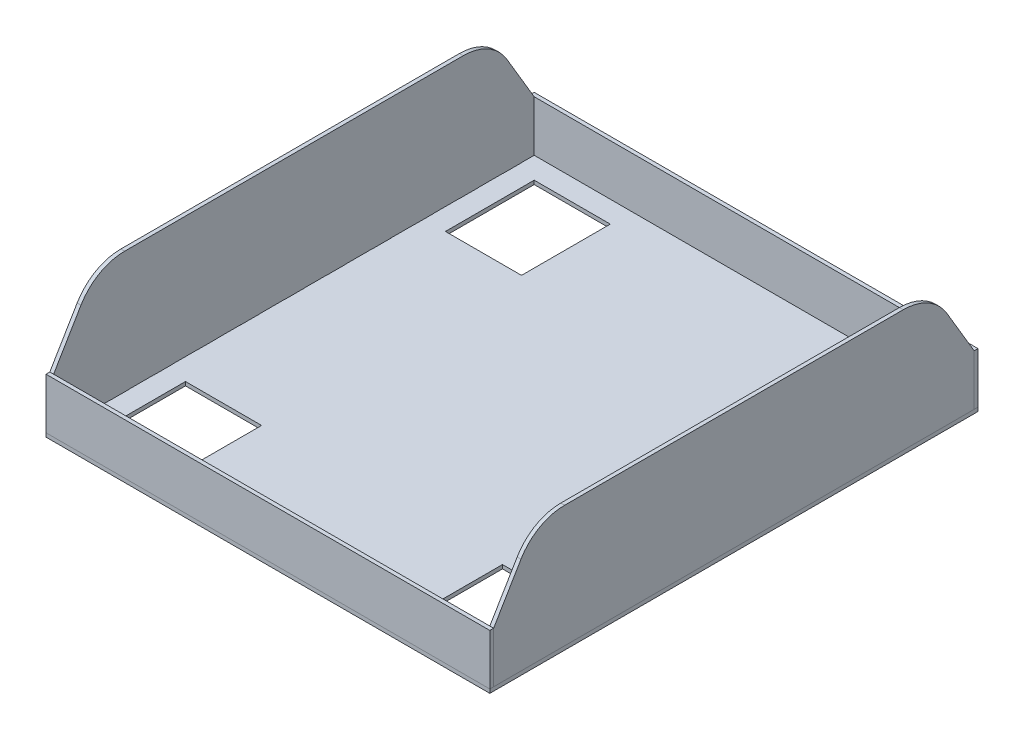
from build123d import *

# Parameters (mm, degrees)
CROQUIS1_W                             = 350
CROQUIS1_H                             = 385
CROQUIS1_W_2                           = 60
CROQUIS1_H_2                           = 70
SALIENTE_EXTRUIR1_DEPTH                = 3
CROQUIS4_W                             = 350
CROQUIS4_H                             = 3
SALIENTE_EXTRUIR4_DEPTH                = 40
CROQUIS5_W                             = 350
CROQUIS5_H                             = 3
SALIENTE_EXTRUIR5_DEPTH                = 40
SALIENTE_EXTRUIR6_DEPTH                = 3
SALIENTE_EXTRUIR7_DEPTH                = 3
PESTA_A_START                          = -179.5
PESTA_A_Y_RANURA_PESTA_A1_OUTLINE_W    = 3
PESTA_A_Y_RANURA_PESTA_A1_OUTLINE_H    = 3
PESTA_A_Y_RANURA_PESTA_A1_DEPTH        = 15
PESTA_A_START_2                        = -145.1
PESTA_A_Y_RANURA_PESTA_A1_2_OUTLINE_W  = 3
PESTA_A_Y_RANURA_PESTA_A1_2_OUTLINE_H  = 3
PESTA_A_Y_RANURA_PESTA_A1_2_DEPTH      = 15
PESTA_A_START_3                        = -110.7
PESTA_A_Y_RANURA_PESTA_A1_3_OUTLINE_W  = 3
PESTA_A_Y_RANURA_PESTA_A1_3_OUTLINE_H  = 3
PESTA_A_Y_RANURA_PESTA_A1_3_DEPTH      = 15
PESTA_A_START_4                        = -76.3
PESTA_A_Y_RANURA_PESTA_A1_4_OUTLINE_W  = 3
PESTA_A_Y_RANURA_PESTA_A1_4_OUTLINE_H  = 3
PESTA_A_Y_RANURA_PESTA_A1_4_DEPTH      = 15
PESTA_A_START_5                        = -41.9
PESTA_A_Y_RANURA_PESTA_A1_5_OUTLINE_W  = 3
PESTA_A_Y_RANURA_PESTA_A1_5_OUTLINE_H  = 3
PESTA_A_Y_RANURA_PESTA_A1_5_DEPTH      = 15
PESTA_A_START_6                        = -7.5
PESTA_A_Y_RANURA_PESTA_A1_6_OUTLINE_W  = 3
PESTA_A_Y_RANURA_PESTA_A1_6_OUTLINE_H  = 3
PESTA_A_Y_RANURA_PESTA_A1_6_DEPTH      = 15
PESTA_A_START_7                        = 26.9
PESTA_A_Y_RANURA_PESTA_A1_7_OUTLINE_W  = 3
PESTA_A_Y_RANURA_PESTA_A1_7_OUTLINE_H  = 3
PESTA_A_Y_RANURA_PESTA_A1_7_DEPTH      = 15
PESTA_A_START_8                        = 61.3
PESTA_A_Y_RANURA_PESTA_A1_8_OUTLINE_W  = 3
PESTA_A_Y_RANURA_PESTA_A1_8_OUTLINE_H  = 3
PESTA_A_Y_RANURA_PESTA_A1_8_DEPTH      = 15
PESTA_A_START_9                        = 95.7
PESTA_A_Y_RANURA_PESTA_A1_9_OUTLINE_W  = 3
PESTA_A_Y_RANURA_PESTA_A1_9_OUTLINE_H  = 3
PESTA_A_Y_RANURA_PESTA_A1_9_DEPTH      = 15
PESTA_A_START_10                       = 130.1
PESTA_A_Y_RANURA_PESTA_A1_10_OUTLINE_W = 3
PESTA_A_Y_RANURA_PESTA_A1_10_OUTLINE_H = 3
PESTA_A_Y_RANURA_PESTA_A1_10_DEPTH     = 15
PESTA_A_START_11                       = 164.5
PESTA_A_Y_RANURA_PESTA_A1_11_OUTLINE_W = 3
PESTA_A_Y_RANURA_PESTA_A1_11_OUTLINE_H = 3
PESTA_A_Y_RANURA_PESTA_A1_11_DEPTH     = 15
PESTA_A_START_12                       = -179.6
PESTA_A_Y_RANURA_RANURA1_OUTLINE_W     = 3.1
PESTA_A_Y_RANURA_RANURA1_OUTLINE_H     = 3
PESTA_A_Y_RANURA_RANURA1_DEPTH         = 15.2
PESTA_A_START_13                       = -145.2
PESTA_A_Y_RANURA_RANURA1_2_OUTLINE_W   = 3.1
PESTA_A_Y_RANURA_RANURA1_2_OUTLINE_H   = 3
PESTA_A_Y_RANURA_RANURA1_2_DEPTH       = 15.2
PESTA_A_START_14                       = -110.8
PESTA_A_Y_RANURA_RANURA1_3_OUTLINE_W   = 3.1
PESTA_A_Y_RANURA_RANURA1_3_OUTLINE_H   = 3
PESTA_A_Y_RANURA_RANURA1_3_DEPTH       = 15.2
PESTA_A_START_15                       = -76.4
PESTA_A_Y_RANURA_RANURA1_4_OUTLINE_W   = 3.1
PESTA_A_Y_RANURA_RANURA1_4_OUTLINE_H   = 3
PESTA_A_Y_RANURA_RANURA1_4_DEPTH       = 15.2
PESTA_A_START_16                       = -42
PESTA_A_Y_RANURA_RANURA1_5_OUTLINE_W   = 3.1
PESTA_A_Y_RANURA_RANURA1_5_OUTLINE_H   = 3
PESTA_A_Y_RANURA_RANURA1_5_DEPTH       = 15.2
PESTA_A_START_17                       = -7.6
PESTA_A_Y_RANURA_RANURA1_6_OUTLINE_W   = 3.1
PESTA_A_Y_RANURA_RANURA1_6_OUTLINE_H   = 3
PESTA_A_Y_RANURA_RANURA1_6_DEPTH       = 15.2
PESTA_A_START_18                       = 26.8
PESTA_A_Y_RANURA_RANURA1_7_OUTLINE_W   = 3.1
PESTA_A_Y_RANURA_RANURA1_7_OUTLINE_H   = 3
PESTA_A_Y_RANURA_RANURA1_7_DEPTH       = 15.2
PESTA_A_START_19                       = 61.2
PESTA_A_Y_RANURA_RANURA1_8_OUTLINE_W   = 3.1
PESTA_A_Y_RANURA_RANURA1_8_OUTLINE_H   = 3
PESTA_A_Y_RANURA_RANURA1_8_DEPTH       = 15.2
PESTA_A_START_20                       = 95.6
PESTA_A_Y_RANURA_RANURA1_9_OUTLINE_W   = 3.1
PESTA_A_Y_RANURA_RANURA1_9_OUTLINE_H   = 3
PESTA_A_Y_RANURA_RANURA1_9_DEPTH       = 15.2
PESTA_A_START_21                       = 130
PESTA_A_Y_RANURA_RANURA1_10_OUTLINE_W  = 3.1
PESTA_A_Y_RANURA_RANURA1_10_OUTLINE_H  = 3
PESTA_A_Y_RANURA_RANURA1_10_DEPTH      = 15.2
PESTA_A_START_22                       = 164.4
PESTA_A_Y_RANURA_RANURA1_11_OUTLINE_W  = 3.1
PESTA_A_Y_RANURA_RANURA1_11_OUTLINE_H  = 3
PESTA_A_Y_RANURA_RANURA1_11_DEPTH      = 15.2


# Read off the part's stored shape, not the designer's step: Pestaña y ranura-Pestaña1, Pestaña y ranura-Ranura1
with BuildPart() as part:
    # Croquis1 → Saliente-Extruir1 (new body)
    with BuildSketch(Plane(origin=(0, 0, 0), x_dir=(1, 0, 0), z_dir=(0, 1, 0))):
        Rectangle(CROQUIS1_W, CROQUIS1_H)
        with Locations((-125, 137.5)):
            Rectangle(CROQUIS1_W_2, CROQUIS1_H_2, mode=Mode.SUBTRACT)
        with Locations((125, 137.5)):
            Rectangle(CROQUIS1_W_2, CROQUIS1_H_2, mode=Mode.SUBTRACT)
        with Locations((-125, -137.5)):
            Rectangle(CROQUIS1_W_2, CROQUIS1_H_2, mode=Mode.SUBTRACT)
        with Locations((125, -137.5)):
            Rectangle(CROQUIS1_W_2, CROQUIS1_H_2, mode=Mode.SUBTRACT)
    extrude(amount=SALIENTE_EXTRUIR1_DEPTH)

    # Pestaña y ranura-Ranura1 outline → Pestaña y ranura-Ranura1 (cut)
    with BuildSketch(Plane.XY.offset(PESTA_A_START_12)):
        with Locations((-173.45, 1.5)):
            Rectangle(PESTA_A_Y_RANURA_RANURA1_OUTLINE_W, PESTA_A_Y_RANURA_RANURA1_OUTLINE_H)
    extrude(amount=PESTA_A_Y_RANURA_RANURA1_DEPTH, mode=Mode.SUBTRACT)

    # Pesta_a y ranura-Ranura1 2 outline → Pesta_a y ranura-Ranura1 2 (cut)
    with BuildSketch(Plane.XY.offset(PESTA_A_START_13)):
        with Locations((-173.45, 1.5)):
            Rectangle(PESTA_A_Y_RANURA_RANURA1_2_OUTLINE_W, PESTA_A_Y_RANURA_RANURA1_2_OUTLINE_H)
    extrude(amount=PESTA_A_Y_RANURA_RANURA1_2_DEPTH, mode=Mode.SUBTRACT)

    # Pesta_a y ranura-Ranura1 3 outline → Pesta_a y ranura-Ranura1 3 (cut)
    with BuildSketch(Plane.XY.offset(PESTA_A_START_14)):
        with Locations((-173.45, 1.5)):
            Rectangle(PESTA_A_Y_RANURA_RANURA1_3_OUTLINE_W, PESTA_A_Y_RANURA_RANURA1_3_OUTLINE_H)
    extrude(amount=PESTA_A_Y_RANURA_RANURA1_3_DEPTH, mode=Mode.SUBTRACT)

    # Pesta_a y ranura-Ranura1 4 outline → Pesta_a y ranura-Ranura1 4 (cut)
    with BuildSketch(Plane.XY.offset(PESTA_A_START_15)):
        with Locations((-173.45, 1.5)):
            Rectangle(PESTA_A_Y_RANURA_RANURA1_4_OUTLINE_W, PESTA_A_Y_RANURA_RANURA1_4_OUTLINE_H)
    extrude(amount=PESTA_A_Y_RANURA_RANURA1_4_DEPTH, mode=Mode.SUBTRACT)

    # Pesta_a y ranura-Ranura1 5 outline → Pesta_a y ranura-Ranura1 5 (cut)
    with BuildSketch(Plane.XY.offset(PESTA_A_START_16)):
        with Locations((-173.45, 1.5)):
            Rectangle(PESTA_A_Y_RANURA_RANURA1_5_OUTLINE_W, PESTA_A_Y_RANURA_RANURA1_5_OUTLINE_H)
    extrude(amount=PESTA_A_Y_RANURA_RANURA1_5_DEPTH, mode=Mode.SUBTRACT)

    # Pesta_a y ranura-Ranura1 6 outline → Pesta_a y ranura-Ranura1 6 (cut)
    with BuildSketch(Plane.XY.offset(PESTA_A_START_17)):
        with Locations((-173.45, 1.5)):
            Rectangle(PESTA_A_Y_RANURA_RANURA1_6_OUTLINE_W, PESTA_A_Y_RANURA_RANURA1_6_OUTLINE_H)
    extrude(amount=PESTA_A_Y_RANURA_RANURA1_6_DEPTH, mode=Mode.SUBTRACT)

    # Pesta_a y ranura-Ranura1 7 outline → Pesta_a y ranura-Ranura1 7 (cut)
    with BuildSketch(Plane.XY.offset(PESTA_A_START_18)):
        with Locations((-173.45, 1.5)):
            Rectangle(PESTA_A_Y_RANURA_RANURA1_7_OUTLINE_W, PESTA_A_Y_RANURA_RANURA1_7_OUTLINE_H)
    extrude(amount=PESTA_A_Y_RANURA_RANURA1_7_DEPTH, mode=Mode.SUBTRACT)

    # Pesta_a y ranura-Ranura1 8 outline → Pesta_a y ranura-Ranura1 8 (cut)
    with BuildSketch(Plane.XY.offset(PESTA_A_START_19)):
        with Locations((-173.45, 1.5)):
            Rectangle(PESTA_A_Y_RANURA_RANURA1_8_OUTLINE_W, PESTA_A_Y_RANURA_RANURA1_8_OUTLINE_H)
    extrude(amount=PESTA_A_Y_RANURA_RANURA1_8_DEPTH, mode=Mode.SUBTRACT)

    # Pesta_a y ranura-Ranura1 9 outline → Pesta_a y ranura-Ranura1 9 (cut)
    with BuildSketch(Plane.XY.offset(PESTA_A_START_20)):
        with Locations((-173.45, 1.5)):
            Rectangle(PESTA_A_Y_RANURA_RANURA1_9_OUTLINE_W, PESTA_A_Y_RANURA_RANURA1_9_OUTLINE_H)
    extrude(amount=PESTA_A_Y_RANURA_RANURA1_9_DEPTH, mode=Mode.SUBTRACT)

    # Pesta_a y ranura-Ranura1 10 outline → Pesta_a y ranura-Ranura1 10 (cut)
    with BuildSketch(Plane.XY.offset(PESTA_A_START_21)):
        with Locations((-173.45, 1.5)):
            Rectangle(PESTA_A_Y_RANURA_RANURA1_10_OUTLINE_W, PESTA_A_Y_RANURA_RANURA1_10_OUTLINE_H)
    extrude(amount=PESTA_A_Y_RANURA_RANURA1_10_DEPTH, mode=Mode.SUBTRACT)

    # Pesta_a y ranura-Ranura1 11 outline → Pesta_a y ranura-Ranura1 11 (cut)
    with BuildSketch(Plane.XY.offset(PESTA_A_START_22)):
        with Locations((-173.45, 1.5)):
            Rectangle(PESTA_A_Y_RANURA_RANURA1_11_OUTLINE_W, PESTA_A_Y_RANURA_RANURA1_11_OUTLINE_H)
    extrude(amount=PESTA_A_Y_RANURA_RANURA1_11_DEPTH, mode=Mode.SUBTRACT)


with BuildPart() as body_2:
    # Croquis4 → Saliente-Extruir4 (new body)
    with BuildSketch(Plane(origin=(0, 3, 0), x_dir=(1, 0, 0), z_dir=(0, 1, 0))):
        with Locations((0, 191)):
            Rectangle(CROQUIS4_W, CROQUIS4_H)
    extrude(amount=SALIENTE_EXTRUIR4_DEPTH)


with BuildPart() as body_3:
    # Croquis5 → Saliente-Extruir5 (new body)
    with BuildSketch(Plane(origin=(0, 3, 0), x_dir=(1, 0, 0), z_dir=(0, 1, 0))):
        with Locations((0, -191)):
            Rectangle(CROQUIS5_W, CROQUIS5_H)
    extrude(amount=SALIENTE_EXTRUIR5_DEPTH)


with BuildPart() as body_4:
    # Croquis12 → Saliente-Extruir6 (new body)
    with BuildSketch(Plane(origin=(175, 0, 0), x_dir=(0, 0, -1), z_dir=(1, 0, 0))):
        with BuildLine():
            Line((-189.5, 43), (-189.5, 3))
            Line((-189.5, 3), (189.5, 3))
            Line((189.5, 3), (189.5, 43))
            Line((189.5, 43), (167.902268109, 79.407938381))
            ThreePointArc((167.902268109, 79.407938381), (153.294979979, 93.758578331), (133.5, 99))
            Line((133.5, 99), (-133.5, 99))
            ThreePointArc((-133.5, 99), (-153.294979979, 93.758578331), (-167.902268109, 79.407938381))
            Line((-167.902268109, 79.407938381), (-189.5, 43))
        make_face()
    extrude(amount=-SALIENTE_EXTRUIR6_DEPTH)


with BuildPart() as body_5:
    # Croquis13 → Saliente-Extruir7 (new body)
    with BuildSketch(Plane.ZY.offset(175)):
        with BuildLine():
            Line((-189.5, 43), (-189.5, 3))
            Line((-189.5, 3), (189.5, 3))
            Line((189.5, 3), (189.5, 43))
            Line((189.5, 43), (167.902268109, 79.407938381))
            ThreePointArc((167.902268109, 79.407938381), (153.294979979, 93.758578331), (133.5, 99))
            Line((133.5, 99), (-133.5, 99))
            ThreePointArc((-133.5, 99), (-153.294979979, 93.758578331), (-167.902268109, 79.407938381))
            Line((-167.902268109, 79.407938381), (-189.5, 43))
        make_face()
    extrude(amount=-SALIENTE_EXTRUIR7_DEPTH)

    # Pestaña y ranura-Pestaña1 outline → Pestaña y ranura-Pestaña1 (add)
    with BuildSketch(Plane.XY.offset(PESTA_A_START)):
        with Locations((-173.5, 1.5)):
            Rectangle(PESTA_A_Y_RANURA_PESTA_A1_OUTLINE_W, PESTA_A_Y_RANURA_PESTA_A1_OUTLINE_H)
    extrude(amount=PESTA_A_Y_RANURA_PESTA_A1_DEPTH)

    # Pesta_a y ranura-Pesta_a1 2 outline → Pesta_a y ranura-Pesta_a1 2 (add)
    with BuildSketch(Plane.XY.offset(PESTA_A_START_2)):
        with Locations((-173.5, 1.5)):
            Rectangle(PESTA_A_Y_RANURA_PESTA_A1_2_OUTLINE_W, PESTA_A_Y_RANURA_PESTA_A1_2_OUTLINE_H)
    extrude(amount=PESTA_A_Y_RANURA_PESTA_A1_2_DEPTH)

    # Pesta_a y ranura-Pesta_a1 3 outline → Pesta_a y ranura-Pesta_a1 3 (add)
    with BuildSketch(Plane.XY.offset(PESTA_A_START_3)):
        with Locations((-173.5, 1.5)):
            Rectangle(PESTA_A_Y_RANURA_PESTA_A1_3_OUTLINE_W, PESTA_A_Y_RANURA_PESTA_A1_3_OUTLINE_H)
    extrude(amount=PESTA_A_Y_RANURA_PESTA_A1_3_DEPTH)

    # Pesta_a y ranura-Pesta_a1 4 outline → Pesta_a y ranura-Pesta_a1 4 (add)
    with BuildSketch(Plane.XY.offset(PESTA_A_START_4)):
        with Locations((-173.5, 1.5)):
            Rectangle(PESTA_A_Y_RANURA_PESTA_A1_4_OUTLINE_W, PESTA_A_Y_RANURA_PESTA_A1_4_OUTLINE_H)
    extrude(amount=PESTA_A_Y_RANURA_PESTA_A1_4_DEPTH)

    # Pesta_a y ranura-Pesta_a1 5 outline → Pesta_a y ranura-Pesta_a1 5 (add)
    with BuildSketch(Plane.XY.offset(PESTA_A_START_5)):
        with Locations((-173.5, 1.5)):
            Rectangle(PESTA_A_Y_RANURA_PESTA_A1_5_OUTLINE_W, PESTA_A_Y_RANURA_PESTA_A1_5_OUTLINE_H)
    extrude(amount=PESTA_A_Y_RANURA_PESTA_A1_5_DEPTH)

    # Pesta_a y ranura-Pesta_a1 6 outline → Pesta_a y ranura-Pesta_a1 6 (add)
    with BuildSketch(Plane.XY.offset(PESTA_A_START_6)):
        with Locations((-173.5, 1.5)):
            Rectangle(PESTA_A_Y_RANURA_PESTA_A1_6_OUTLINE_W, PESTA_A_Y_RANURA_PESTA_A1_6_OUTLINE_H)
    extrude(amount=PESTA_A_Y_RANURA_PESTA_A1_6_DEPTH)

    # Pesta_a y ranura-Pesta_a1 7 outline → Pesta_a y ranura-Pesta_a1 7 (add)
    with BuildSketch(Plane.XY.offset(PESTA_A_START_7)):
        with Locations((-173.5, 1.5)):
            Rectangle(PESTA_A_Y_RANURA_PESTA_A1_7_OUTLINE_W, PESTA_A_Y_RANURA_PESTA_A1_7_OUTLINE_H)
    extrude(amount=PESTA_A_Y_RANURA_PESTA_A1_7_DEPTH)

    # Pesta_a y ranura-Pesta_a1 8 outline → Pesta_a y ranura-Pesta_a1 8 (add)
    with BuildSketch(Plane.XY.offset(PESTA_A_START_8)):
        with Locations((-173.5, 1.5)):
            Rectangle(PESTA_A_Y_RANURA_PESTA_A1_8_OUTLINE_W, PESTA_A_Y_RANURA_PESTA_A1_8_OUTLINE_H)
    extrude(amount=PESTA_A_Y_RANURA_PESTA_A1_8_DEPTH)

    # Pesta_a y ranura-Pesta_a1 9 outline → Pesta_a y ranura-Pesta_a1 9 (add)
    with BuildSketch(Plane.XY.offset(PESTA_A_START_9)):
        with Locations((-173.5, 1.5)):
            Rectangle(PESTA_A_Y_RANURA_PESTA_A1_9_OUTLINE_W, PESTA_A_Y_RANURA_PESTA_A1_9_OUTLINE_H)
    extrude(amount=PESTA_A_Y_RANURA_PESTA_A1_9_DEPTH)

    # Pesta_a y ranura-Pesta_a1 10 outline → Pesta_a y ranura-Pesta_a1 10 (add)
    with BuildSketch(Plane.XY.offset(PESTA_A_START_10)):
        with Locations((-173.5, 1.5)):
            Rectangle(PESTA_A_Y_RANURA_PESTA_A1_10_OUTLINE_W, PESTA_A_Y_RANURA_PESTA_A1_10_OUTLINE_H)
    extrude(amount=PESTA_A_Y_RANURA_PESTA_A1_10_DEPTH)

    # Pesta_a y ranura-Pesta_a1 11 outline → Pesta_a y ranura-Pesta_a1 11 (add)
    with BuildSketch(Plane.XY.offset(PESTA_A_START_11)):
        with Locations((-173.5, 1.5)):
            Rectangle(PESTA_A_Y_RANURA_PESTA_A1_11_OUTLINE_W, PESTA_A_Y_RANURA_PESTA_A1_11_OUTLINE_H)
    extrude(amount=PESTA_A_Y_RANURA_PESTA_A1_11_DEPTH)


solid = Compound([part.part, body_2.part, body_3.part, body_4.part, body_5.part])
